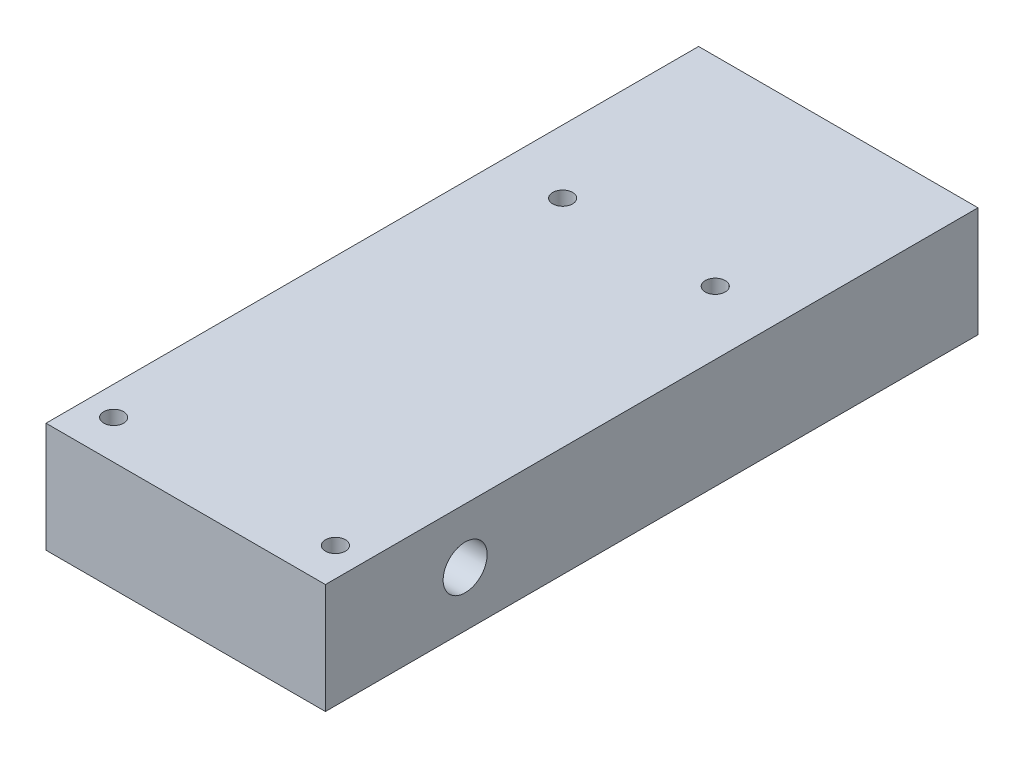
from build123d import *

# Parameters (mm, degrees)
SKETCH1_W           = 101.6
SKETCH1_H           = 237.284389444
SKETCH1_R           = 3.624738262
BOSS_EXTRUDE1_DEPTH = 39.99992
SKETCH2_R           = 2.75
CUT_EXTRUDE1_DEPTH  = 12.7
SKETCH2_5_R         = 14
CUT_EXTRUDE2_DEPTH  = 32
SKETCH2_6_R         = 8
CUT_EXTRUDE3_DEPTH  = 244.318328957
SKETCH3_R           = 2.1
CUT_EXTRUDE4_DEPTH  = 6.35


with BuildPart() as part:
    # Sketch1 → Boss-Extrude1 (new body)
    with BuildSketch(Plane(origin=(0, 0, 0), x_dir=(1, 0, 0), z_dir=(0, 1, 0))):
        with Locations((0, 98.800339311)):
            Rectangle(SKETCH1_W, SKETCH1_H)
        with Locations((-40.32062291, -5.716007511)):
            Circle(SKETCH1_R, mode=Mode.SUBTRACT)
        with Locations((40.32062291, -5.716007511)):
            Circle(SKETCH1_R, mode=Mode.SUBTRACT)
        with Locations((-27.744990659, 144.952451062)):
            Circle(SKETCH1_R, mode=Mode.SUBTRACT)
        with Locations((27.744990659, 144.952451062)):
            Circle(SKETCH1_R, mode=Mode.SUBTRACT)
    extrude(amount=-BOSS_EXTRUDE1_DEPTH)

    # Sketch2 → Cut-Extrude1 (cut)
    with BuildSketch(Plane.ZY.offset(50.8)):
        with Locations((-17.523115746, -33.435028843)):
            Circle(SKETCH2_R)
        with Locations((-11.958144589, -20)):
            Circle(SKETCH2_R)
        with Locations((-17.523115746, -6.564971157)):
            Circle(SKETCH2_R)
        with Locations((-44.393173431, -33.435028843)):
            Circle(SKETCH2_R)
        with Locations((-49.958144589, -20)):
            Circle(SKETCH2_R)
        with Locations((-44.393173431, -6.564971157)):
            Circle(SKETCH2_R)
    extrude(amount=-CUT_EXTRUDE1_DEPTH, mode=Mode.SUBTRACT)

    # Sketch2<5> → Cut-Extrude2 (cut)
    with BuildSketch(Plane.ZY.offset(50.8)):
        with Locations((-30.958144589, -20)):
            Circle(SKETCH2_5_R)
    extrude(amount=-CUT_EXTRUDE2_DEPTH, mode=Mode.SUBTRACT)

    # Sketch2<6> → Cut-Extrude3 (cut, through all)
    with BuildSketch(Plane.ZY.offset(50.8)):
        with Locations((-30.958144589, -20)):
            Circle(SKETCH2_6_R)
    extrude(amount=-CUT_EXTRUDE3_DEPTH, mode=Mode.SUBTRACT)

    # Sketch3 → Cut-Extrude4 (cut)
    with BuildSketch(Plane.XZ.offset(39.99992)):
        with Locations((-18.218963095, -10.458144589)):
            Circle(SKETCH3_R)
        with Locations((-44.218963095, -10.458144589)):
            Circle(SKETCH3_R)
        with Locations((-18.218963095, -51.458144589)):
            Circle(SKETCH3_R)
        with Locations((-44.218963095, -51.458144589)):
            Circle(SKETCH3_R)
    extrude(amount=-CUT_EXTRUDE4_DEPTH, mode=Mode.SUBTRACT)


solid = part.part
